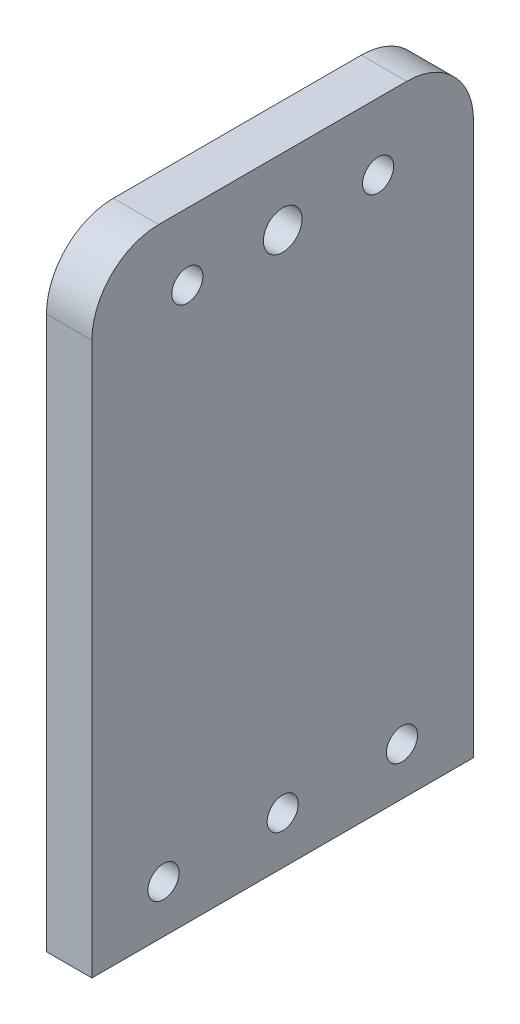
from build123d import *

# Parameters (mm, degrees)
BOSS_EXTRUDE1_DEPTH   = 4.7625
F_4_CLEARANCE_HOLE4_D = 3.2639
SKETCH10_R            = 2.025
CUT_EXTRUDE1_DEPTH    = 10
F_4_CLEARANCE_HOLE3_D = 3.2639


with BuildPart() as part:
    # Sketch1 → Boss-Extrude1 (new body)
    with BuildSketch(Plane(origin=(0, 0, 0), x_dir=(0, 0, -1), z_dir=(1, 0, 0))):
        with BuildLine():
            Line((0, 57.9), (0, 0))
            Line((0, 0), (40, 0))
            Line((40, 0), (40, 57.9))
            ThreePointArc((40, 57.9), (37.949747468, 62.849747468), (33, 64.9))
            Line((33, 64.9), (7, 64.9))
            ThreePointArc((7, 64.9), (2.050252532, 62.849747468), (0, 57.9))
        make_face()
    extrude(amount=BOSS_EXTRUDE1_DEPTH)

    # #4 Clearance Hole4 (through all)
    with Locations(Plane(origin=(4.7625, 0, 0), x_dir=(0, 0, -1), z_dir=(1, 0, 0))):
        with Locations((7.5, 5), (20, 5), (32.5, 5)):
            Hole(F_4_CLEARANCE_HOLE4_D / 2)

    # Sketch10 → Cut-Extrude1 (cut)
    with BuildSketch(Plane(origin=(4.7625, 0, 0), x_dir=(0, 0, -1), z_dir=(1, 0, 0))):
        with Locations((20, 57.9)):
            Circle(SKETCH10_R)
    extrude(amount=-CUT_EXTRUDE1_DEPTH, mode=Mode.SUBTRACT)

    # #4 Clearance Hole3 (through all)
    with Locations(Plane(origin=(4.7625, 0, 0), x_dir=(0, 0, -1), z_dir=(1, 0, 0))):
        with Locations((10, 57.9), (30, 57.9)):
            Hole(F_4_CLEARANCE_HOLE3_D / 2)


solid = part.part
